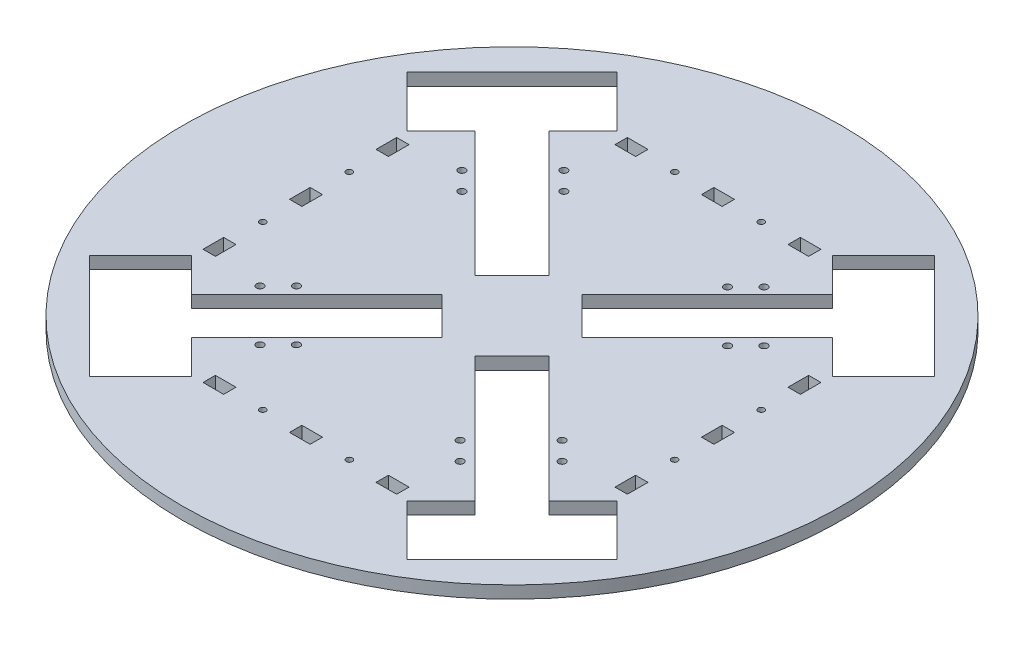
from build123d import *

# Parameters (mm, degrees)
SKETCH1_R           = 160
BOSS_EXTRUDE1_DEPTH = 6
CUT_EXTRUDE1_DEPTH  = 368.744476505
CUT_EXTRUDE2_DEPTH  = 368.744476505
SKETCH7_R           = 1.75
CUT_EXTRUDE3_DEPTH  = 368.744476505
SKETCH9_R           = 1.5
SKETCH9_W           = 6
SKETCH9_H           = 10
CUT_EXTRUDE4_DEPTH  = 368.744476505
CIRPATTERN1_COUNT   = 4


with BuildPart() as part:
    # Sketch1 → Boss-Extrude1 (new body)
    with BuildSketch(Plane(origin=(0, 0, 0), x_dir=(1, 0, 0), z_dir=(0, 1, 0))):
        with Locations((-100, 100)):
            Circle(SKETCH1_R)
    extrude(amount=BOSS_EXTRUDE1_DEPTH)

    # Sketch3 → Cut-Extrude1 (cut, through all)
    with BuildSketch(Plane.XZ):
        Polygon((-22.925360851, -227.986327395), (-47.674098192, -203.237590053), (3.237590053, -152.325901808), (27.986327395, -177.074639149), align=None)
        Polygon((3.237590053, -47.674098192), (27.986327395, -22.925360851), (-22.925360851, 27.986327395), (-47.674098192, 3.237590053), align=None)
        Polygon((-152.325901808, 3.237590053), (-177.074639149, 27.986327395), (-227.986327395, -22.925360851), (-203.237590053, -47.674098192), align=None)
        Polygon((-177.074639149, -227.986327395), (-152.325901808, -203.237590053), (-203.237590053, -152.325901808), (-227.986327395, -177.074639149), align=None)
    extrude(amount=-CUT_EXTRUDE1_DEPTH, mode=Mode.SUBTRACT)

    # Sketch4 → Cut-Extrude2 (cut, through all)
    with BuildSketch(Plane.XZ):
        Polygon((-74.013825791, -92.045048712), (-13.202642609, -31.23386553), (-31.23386553, -13.202642609), (-92.045048712, -74.013825791), align=None)
        Polygon((-107.954951288, -74.013825791), (-168.76613447, -13.202642609), (-186.797357391, -31.23386553), (-125.986174209, -92.045048712), align=None)
        Polygon((-125.986174209, -107.954951288), (-186.797357391, -168.76613447), (-168.76613447, -186.797357391), (-107.954951288, -125.986174209), align=None)
        Polygon((-31.23386553, -186.797357391), (-13.202642609, -168.76613447), (-74.013825791, -107.954951288), (-92.045048712, -125.986174209), align=None)
    extrude(amount=-CUT_EXTRUDE2_DEPTH, mode=Mode.SUBTRACT)

    # Sketch7 → Cut-Extrude3 (cut, through all)
    with BuildSketch(Plane.XZ):
        with Locations((-149.002499936, -26.673026791)):
            Circle(SKETCH7_R)
        with Locations((-148.578235868, -173.751237278)):
            Circle(SKETCH7_R)
        with Locations((-140.163665171, -35.511861556)):
            Circle(SKETCH7_R)
        with Locations((-164.912402513, -60.260598897)):
            Circle(SKETCH7_R)
        with Locations((-173.751237278, -51.421764132)):
            Circle(SKETCH7_R)
        with Locations((-173.326973209, -149.002499936)):
            Circle(SKETCH7_R)
        with Locations((-164.488138444, -140.163665171)):
            Circle(SKETCH7_R)
        with Locations((-139.739401103, -164.912402513)):
            Circle(SKETCH7_R)
        with Locations((-26.673026791, -50.997500064)):
            Circle(SKETCH7_R)
        with Locations((-35.511861556, -59.836334829)):
            Circle(SKETCH7_R)
        with Locations((-60.260598897, -35.087597487)):
            Circle(SKETCH7_R)
        with Locations((-51.421764132, -26.248762722)):
            Circle(SKETCH7_R)
        with Locations((-50.997500064, -173.326973209)):
            Circle(SKETCH7_R)
        with Locations((-59.836334829, -164.488138444)):
            Circle(SKETCH7_R)
        with Locations((-35.087597487, -139.739401103)):
            Circle(SKETCH7_R)
        with Locations((-26.248762722, -148.578235868)):
            Circle(SKETCH7_R)
    extrude(amount=-CUT_EXTRUDE3_DEPTH, mode=Mode.SUBTRACT)

    # Sketch9 → Cut-Extrude4 (cut, through all)
    with BuildSketch(Plane.XZ):
        with Locations((0, -79)):
            Circle(SKETCH9_R)
        with Locations((0, -121)):
            Circle(SKETCH9_R)
        with Locations((0, -142)):
            Rectangle(SKETCH9_W, SKETCH9_H)
        with Locations((0, -100)):
            Rectangle(SKETCH9_W, SKETCH9_H)
        with Locations((0, -58)):
            Rectangle(SKETCH9_W, SKETCH9_H)
    cut_extrude4 = extrude(amount=-CUT_EXTRUDE4_DEPTH, mode=Mode.SUBTRACT)

    # CirPattern1: Cut-Extrude4 ×4 about axis
    cirpattern1_axis = Axis((-100, 0, -100), (0, 1, 0))
    for i in range(1, CIRPATTERN1_COUNT):
        add(cut_extrude4.rotate(cirpattern1_axis, i * 360 / CIRPATTERN1_COUNT), mode=Mode.SUBTRACT)


solid = part.part
